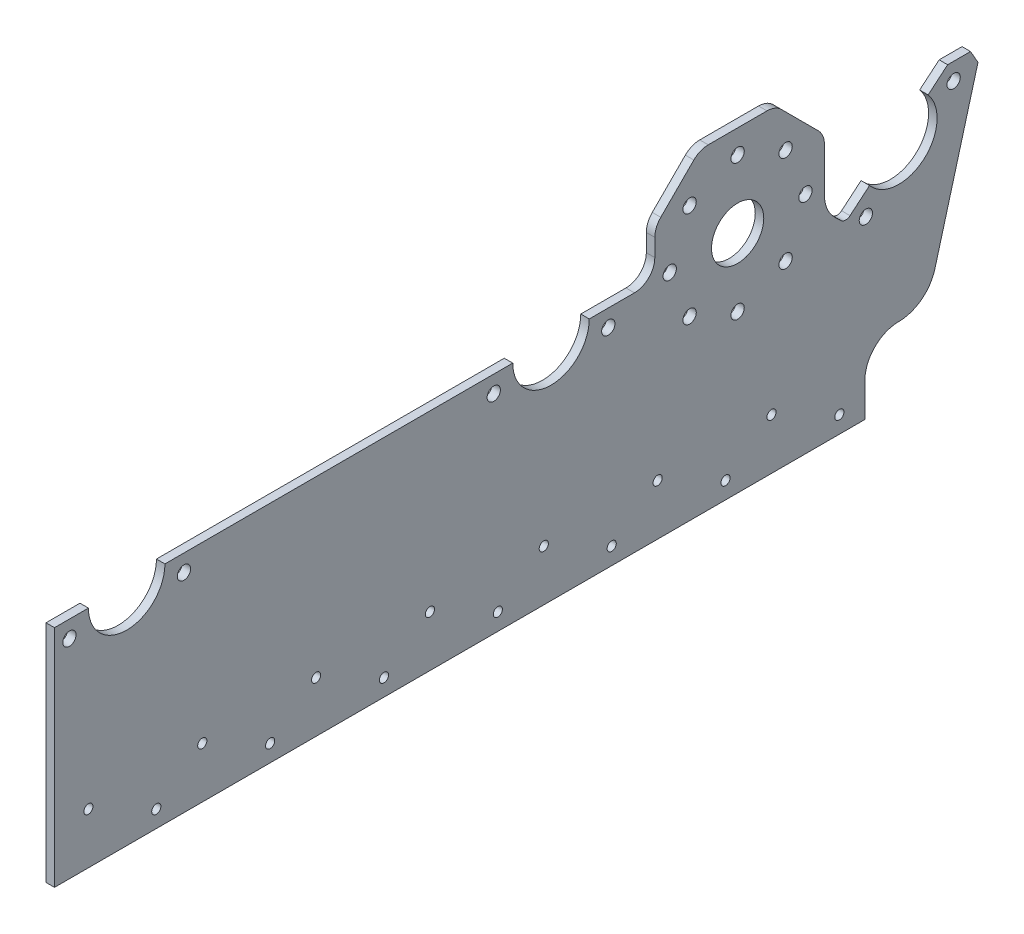
from build123d import *

# Parameters (mm, degrees)
SKETCH1_R                        = 9.779
SKETCH1_R_2                      = 2.413
BOSS_EXTRUDE1_DEPTH              = 3.175
F_10_CLEARANCE_HOLE1_D           = 4.9784
F_10_CLEARANCE_HOLE2_D           = 4.9784
F_10_CLEARANCE_HOLE2_DEPTH       = 3.175
F_10_CLEARANCE_HOLE2_TIP         = 1.495662253
CHAMFER1_SIZE                    = 5.08
CHAMFER1_SIZE2                   = 4.1342197
FILLET1_R                        = 7.62
F_1_8_0_135_DIAMETER_HOLE1_D     = 3.429
F_1_8_0_135_DIAMETER_HOLE1_DEPTH = 16.51
F_1_8_0_135_DIAMETER_HOLE1_TIP   = 1.030175531


with BuildPart() as part:
    # Sketch1 → Boss-Extrude1 (new body)
    with BuildSketch(Plane(origin=(0, 0, 0), x_dir=(0, 0, -1), z_dir=(1, 0, 0))):
        with BuildLine():
            Line((-12.7, -12.7), (-315.9379, -12.7))
            Line((-315.9379, -12.7), (-315.9379, 71.4629))
            Line((-315.9379, 71.4629), (-303.2379, 71.4629))
            ThreePointArc((-303.2379, 71.4629), (-288.925, 57.15), (-274.6121, 71.4629))
            Line((-274.6121, 71.4629), (-144.4625, 71.4629))
            ThreePointArc((-144.4625, 71.4629), (-130.1496, 57.15), (-115.8367, 71.4629))
            Line((-115.8367, 71.4629), (-91.313, 71.4629))
            Line((-91.313, 71.4629), (-91.313, 88.788677931))
            Line((-91.313, 88.788677931), (-74.475777931, 105.6259))
            Line((-74.475777931, 105.6259), (-46.174222069, 105.6259))
            Line((-46.174222069, 105.6259), (-27.855333333, 87.307011265))
            Line((-27.855333333, 87.307011265), (-27.855333333, 67.615437998))
            ThreePointArc((-27.855333333, 67.615437998), (-26.836905275, 62.632379001), (-23.944959008, 58.448514823))
            Line((-23.944959008, 58.448514823), (-21.653228214, 56.251108404))
            ThreePointArc((-21.653228214, 56.251108404), (-19.979435171, 55.545886769), (-18.262622551, 56.138740153))
            Line((-18.262622551, 56.138740153), (-10.96431751, 62.262745221))
            ThreePointArc((-10.96431751, 62.262745221), (9.200154779, 60.49858249), (10.96431751, 80.663054779))
            Line((10.96431751, 80.663054779), (18.262622551, 86.787059847))
            Line((18.262622551, 86.787059847), (30.962622551, 86.787059847))
            Line((30.962622551, 86.787059847), (13.473085073, 22.977185543))
            ThreePointArc((13.473085073, 22.977185543), (8.472670241, 15.562580904), (0, 12.7))
            ThreePointArc((0, 12.7), (-8.980256121, 8.980256121), (-12.7, 0))
            Line((-12.7, 0), (-12.7, -12.7))
        make_face()
        with Locations((-60.325, 71.4629)):
            Circle(SKETCH1_R, mode=Mode.SUBTRACT)
        with Locations((-60.325, 96.8629)):
            Circle(SKETCH1_R_2, mode=Mode.SUBTRACT)
        with Locations((-42.364487758, 89.423412242)):
            Circle(SKETCH1_R_2, mode=Mode.SUBTRACT)
        with Locations((-34.925, 71.4629)):
            Circle(SKETCH1_R_2, mode=Mode.SUBTRACT)
        with Locations((-42.364487758, 53.502387758)):
            Circle(SKETCH1_R_2, mode=Mode.SUBTRACT)
        with Locations((-60.325, 46.0629)):
            Circle(SKETCH1_R_2, mode=Mode.SUBTRACT)
        with Locations((-78.285512242, 53.502387758)):
            Circle(SKETCH1_R_2, mode=Mode.SUBTRACT)
        with Locations((-85.725, 71.4629)):
            Circle(SKETCH1_R_2, mode=Mode.SUBTRACT)
        with Locations((-78.285512242, 89.423412242)):
            Circle(SKETCH1_R_2, mode=Mode.SUBTRACT)
    extrude(amount=BOSS_EXTRUDE1_DEPTH)

    # #10 Clearance Hole1 (through all)
    with Locations(Plane(origin=(3.175, 0, 0), x_dir=(0, 0, -1), z_dir=(1, 0, 0))):
        with Locations((-310.35625, 65.1129), (-267.49375, 65.1129), (-151.58085, 65.1129), (-108.71835, 65.1129), (-12.33558865, 52.822775826), (20.498991293, 80.374259746)):
            Hole(F_10_CLEARANCE_HOLE1_D / 2)

    # #10 Clearance Hole2
    with Locations(Plane(origin=(3.175, 0, 0), x_dir=(0, 0, -1), z_dir=(1, 0, 0))):
        with Locations((-60.325, 96.8629), (-42.364487758, 89.423412242), (-34.925, 71.4629), (-42.364487758, 53.502387758), (-60.325, 46.0629), (-78.285512242, 53.502387758), (-85.725, 71.4629), (-78.285512242, 89.423412242)):
            Hole(F_10_CLEARANCE_HOLE2_D / 2, depth=F_10_CLEARANCE_HOLE2_DEPTH)
            with Locations((0, 0, -(F_10_CLEARANCE_HOLE2_DEPTH + F_10_CLEARANCE_HOLE2_TIP / 2))):  # 118° drill point
                Cone(0, F_10_CLEARANCE_HOLE2_D / 2, F_10_CLEARANCE_HOLE2_TIP, mode=Mode.SUBTRACT)

    # Chamfer1
    chamfer1_edges = [part.edges().sort_by_distance(p)[0] for p in [
        (1.5875, 86.787059847, -30.962622551),
    ]]
    chamfer1_side = [part.faces().sort_by_distance(p)[0] for p in [
        (1.5875, 54.882122695, -22.217853812),
    ]]
    chamfer(chamfer1_edges, length=CHAMFER1_SIZE, length2=CHAMFER1_SIZE2, reference=chamfer1_side[0])

    # Fillet1
    fillet1_edges = [part.edges().sort_by_distance(p)[0] for p in [
        (1.5875, 87.307011265, 27.855333333),
        (1.5875, 105.6259, 46.174222069),
        (1.5875, 105.6259, 74.475777931),
        (1.5875, 88.788677931, 91.313),
        (1.5875, 71.4629, 91.313),
    ]]
    fillet(fillet1_edges, radius=FILLET1_R)

    # 1/8 (0.135) Diameter Hole1
    with Locations(Plane.ZY):
        with Locations((22.2504, -6.35), (47.6504, 6.35), (64.848316667, -6.35), (90.248316667, 6.35), (107.446233333, -6.35), (132.846233333, 6.35), (150.04415, -6.35), (175.44415, 6.35), (192.642066667, -6.35), (218.042066667, 6.35), (235.239983333, -6.35), (260.639983333, 6.35), (277.8379, -6.35), (303.2379, 6.35)):
            Hole(F_1_8_0_135_DIAMETER_HOLE1_D / 2, depth=F_1_8_0_135_DIAMETER_HOLE1_DEPTH)
            with Locations((0, 0, -(F_1_8_0_135_DIAMETER_HOLE1_DEPTH + F_1_8_0_135_DIAMETER_HOLE1_TIP / 2))):  # 118° drill point
                Cone(0, F_1_8_0_135_DIAMETER_HOLE1_D / 2, F_1_8_0_135_DIAMETER_HOLE1_TIP, mode=Mode.SUBTRACT)


solid = part.part
